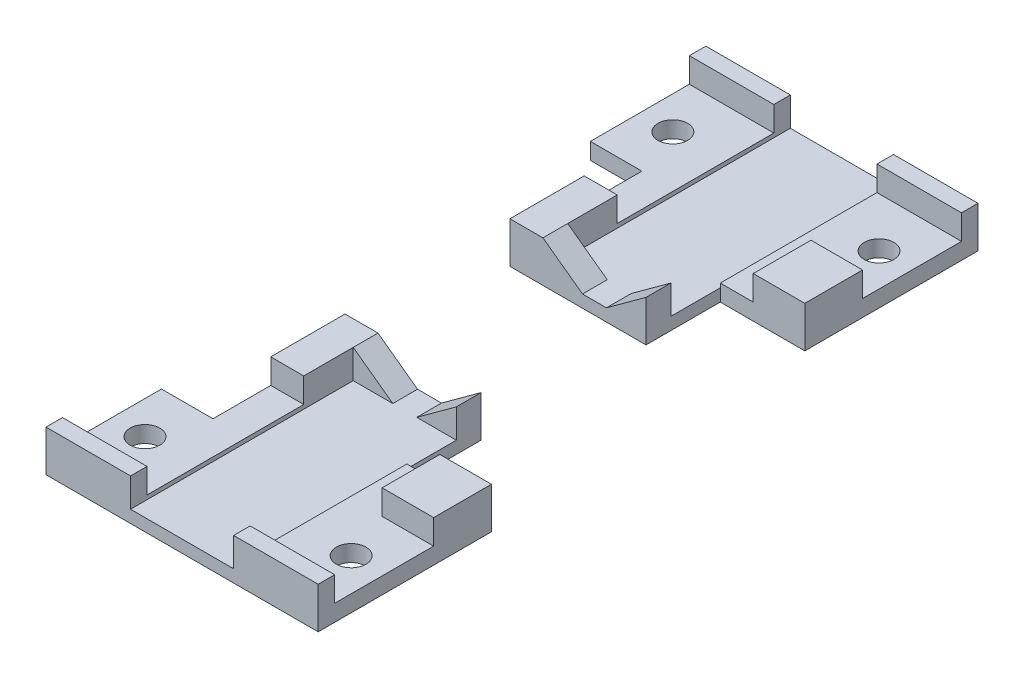
from build123d import *

# Parameters (mm, degrees)
SKETCH1_W                                = 33
SKETCH1_H                                = 30
BOSS_EXTRUDE4_DEPTH                      = 3
SKETCH13_W                               = 10.25
SKETCH13_H                               = 30
BOSS_EXTRUDE5_DEPTH                      = 2
SKETCH14_W                               = 12.5
SKETCH14_H                               = 30
CUT_EXTRUDE7_DEPTH                       = 1.5
BOSS_EXTRUDE6_DEPTH                      = 3
CUT_EXTRUDE12_REACH                      = 56.717
SKETCH25_W                               = 6.25
SKETCH25_H                               = 16
BOSS_EXTRUDE7_DEPTH                      = 23
SKETCH27_W                               = 33
SKETCH27_H                               = 5
BOSS_EXTRUDE8_DEPTH                      = 27
CUT_EXTRUDE13_REACH                      = 56.717
SKETCH28_W                               = 6.25
SKETCH28_H                               = 13
CUT_EXTRUDE16_REACH                      = 56.717
SKETCH29_W                               = 26.75
SKETCH29_H                               = 20
SKETCH30_W                               = 12.5
SKETCH30_H                               = 27
CUT_EXTRUDE17_DEPTH                      = 1.5
CUT_EXTRUDE18_DEPTH                      = 3
CUT_EXTRUDE19_DEPTH                      = 3
SKETCH33_R                               = 1.8
CUT_EXTRUDE20_DEPTH                      = 8
CBORE_START                              = -2.4
CBORE_FOR_M3_PAN_HEAD_SCREW1_OUTLINE_R   = 3.5
CBORE_FOR_M3_PAN_HEAD_SCREW1_DEPTH       = 2.4
CBORE_START_2                            = -5
CBORE_FOR_M3_PAN_HEAD_SCREW1_2_OUTLINE_R = 1.8
CBORE_FOR_M3_PAN_HEAD_SCREW1_2_DEPTH     = 2.6
CUT_EXTRUDE22_DEPTH                      = 1.5
SKETCH39_W                               = 12.5
SKETCH39_H                               = 27
CUT_EXTRUDE24_DEPTH                      = 0.5
SKETCH40_W                               = 9
SKETCH40_H                               = 5
CUT_EXTRUDE26_DEPTH                      = 10.25
SKETCH41_W                               = 9
SKETCH41_H                               = 5
CUT_EXTRUDE27_DEPTH                      = 10.25


# Read off the part's stored shape, not the designer's step: CBORE for M3 Pan Head Screw1
with BuildPart() as part:
    # Sketch1 → Boss-Extrude4 (new body)
    with BuildSketch(Plane(origin=(0, -2, 0), x_dir=(1, 0, 0), z_dir=(0, 1, 0))):
        with Locations((20.5, 25)):
            Rectangle(SKETCH1_W, SKETCH1_H)
    extrude(amount=-BOSS_EXTRUDE4_DEPTH)

    # Sketch13 → Boss-Extrude5 (add)
    with BuildSketch(Plane(origin=(0, -2, 0), x_dir=(1, 0, 0), z_dir=(0, 1, 0))):
        with Locations((9.125, 25)):
            Rectangle(SKETCH13_W, SKETCH13_H)
        with Locations((31.875, 25)):
            Rectangle(SKETCH13_W, SKETCH13_H)
    extrude(amount=BOSS_EXTRUDE5_DEPTH)

    # Sketch14 → Cut-Extrude7 (cut)
    with BuildSketch(Plane(origin=(0, -2, 0), x_dir=(1, 0, 0), z_dir=(0, 1, 0))):
        with Locations((20.5, 25)):
            Rectangle(SKETCH14_W, SKETCH14_H)
    extrude(amount=-CUT_EXTRUDE7_DEPTH, mode=Mode.SUBTRACT)

    # Sketch19 → Boss-Extrude6 (add)
    with BuildSketch(Plane.XY.offset(-10)):
        Polygon((14.25, 0), (19.05, -3.5), (14.25, -3.5), align=None)
    boss_extrude6 = extrude(amount=-BOSS_EXTRUDE6_DEPTH)

    # Mirror3: Boss-Extrude6 across plane
    add(boss_extrude6.mirror(Plane(origin=(20.5, 0, 0), x_dir=(0, 0, 1), z_dir=(1, 0, 0))))

    # Sketch25 → Cut-Extrude12 (cut, up to next)
    with BuildSketch(Plane(origin=(0, 0, 0), x_dir=(1, 0, 0), z_dir=(0, 1, 0)), mode=Mode.PRIVATE) as cut_extrude12_sk1:
        with Locations((7.125, 18)):
            Rectangle(SKETCH25_W, SKETCH25_H)
    cut_extrude12_tool1 = extrude(cut_extrude12_sk1.sketch, amount=-CUT_EXTRUDE12_REACH, mode=Mode.PRIVATE) & part.part
    add(cut_extrude12_tool1.solids().sort_by_distance((7.125, 0, -18))[0], mode=Mode.SUBTRACT)

    # Sketch26 → Boss-Extrude7 (add)
    with BuildSketch(Plane.XY.offset(-10)):
        Polygon((10.25, -5), (10.25, 0), (14.25, 0), (19.05, -3.5), (21.95, -3.5), (26.75, 0), (37, 0), (37, -5), align=None)
    extrude(amount=BOSS_EXTRUDE7_DEPTH)

    # Sketch27 → Boss-Extrude8 (add)
    with BuildSketch(Plane.XY.offset(13)):
        with Locations((20.5, -2.5)):
            Rectangle(SKETCH27_W, SKETCH27_H)
    extrude(amount=BOSS_EXTRUDE8_DEPTH)

    # Sketch28 → Cut-Extrude13 (cut, up to next)
    with BuildSketch(Plane(origin=(0, 0, 0), x_dir=(1, 0, 0), z_dir=(0, 1, 0)), mode=Mode.PRIVATE) as cut_extrude13_sk1:
        with Locations((7.125, -19.5)):
            Rectangle(SKETCH28_W, SKETCH28_H)
    cut_extrude13_tool1 = extrude(cut_extrude13_sk1.sketch, amount=-CUT_EXTRUDE13_REACH, mode=Mode.PRIVATE) & part.part
    add(cut_extrude13_tool1.solids().sort_by_distance((7.125, 0, 19.5))[0], mode=Mode.SUBTRACT)

    # Sketch29 → Cut-Extrude16 (cut, up to next)
    with BuildSketch(Plane(origin=(0, 0, 0), x_dir=(1, 0, 0), z_dir=(0, 1, 0)), mode=Mode.PRIVATE) as cut_extrude16_sk1:
        with Locations((23.625, 0)):
            Rectangle(SKETCH29_W, SKETCH29_H)
    cut_extrude16_tool1 = extrude(cut_extrude16_sk1.sketch, amount=-CUT_EXTRUDE16_REACH, mode=Mode.PRIVATE) & part.part
    add(cut_extrude16_tool1.solids().sort_by_distance((23.625, 0, 0))[0], mode=Mode.SUBTRACT)


with BuildPart() as cut_extrude16_piece_1:
    # of the separate pieces the step leaves, piece 1, a body of its own (cut_extrude16_pieces)
    add(part.part.solids().sort_by_distance((10.25, -5, 26))[0])

    # Sketch30 → Cut-Extrude17 (cut)
    with BuildSketch(Plane(origin=(0, 0, 0), x_dir=(1, 0, 0), z_dir=(0, 1, 0))):
        with Locations((20.5, -26.5)):
            Rectangle(SKETCH30_W, SKETCH30_H)
    extrude(amount=-CUT_EXTRUDE17_DEPTH, mode=Mode.SUBTRACT)

    # Sketch32 → Cut-Extrude19 (cut)
    with BuildSketch(Plane(origin=(0, 0, 0), x_dir=(1, 0, 0), z_dir=(0, 1, 0))):
        Polygon((4, -26), (10.25, -26), (10.25, -19), (14.25, -19), (14.25, -38), (4, -38), align=None)
        Polygon((37, -38), (37, -26), (30.75, -26), (30.75, -19), (26.75, -19), (26.75, -38), align=None)
    extrude(amount=-CUT_EXTRUDE19_DEPTH, mode=Mode.SUBTRACT)


with BuildPart() as cut_extrude16_piece_2:
    # of the separate pieces the step leaves, piece 2, a body of its own (cut_extrude16_pieces)
    add(part.part.solids().sort_by_distance((4, -5, -40))[0])

    # Sketch31 → Cut-Extrude18 (cut)
    with BuildSketch(Plane(origin=(0, 0, 0), x_dir=(1, 0, 0), z_dir=(0, 1, 0))):
        Polygon((4, 38), (14.25, 38), (14.25, 19.008507387), (10.25, 19), (10.25, 26), (4, 26), align=None)
        Polygon((30.75, 19), (26.75, 19), (26.75, 38), (37, 38), (37, 26), (30.75, 26), align=None)
    extrude(amount=-CUT_EXTRUDE18_DEPTH, mode=Mode.SUBTRACT)


with BuildPart() as cut_extrude20_tool:
    # Sketch33 → Cut-Extrude20 (new body)
    with BuildSketch(Plane(origin=(0, 0, 0), x_dir=(1, 0, 0), z_dir=(0, 1, 0))):
        with Locations(Location((8, 32, 0), (0, 0, 270))):
            Circle(SKETCH33_R)
        with Locations(Location((33, 32, 0), (0, 0, 270))):
            Circle(SKETCH33_R)
        with Locations(Location((33, -32, 0), (0, 0, 270))):
            Circle(SKETCH33_R)
        with Locations(Location((8, -32, 0), (0, 0, 270))):
            Circle(SKETCH33_R)
    extrude(amount=-CUT_EXTRUDE20_DEPTH)


with BuildPart() as cut_extrude16_piece_1_1:
    add(cut_extrude16_piece_1.part)

    # Cut-Extrude20: cut by cut_extrude20_tool
    add(cut_extrude20_tool.part, mode=Mode.SUBTRACT)


with BuildPart() as cut_extrude16_piece_2_1:
    add(cut_extrude16_piece_2.part)

    # Cut-Extrude20: cut by cut_extrude20_tool
    add(cut_extrude20_tool.part, mode=Mode.SUBTRACT)


with BuildPart() as cbore_for_m3_pan_head_screw1_tool:
    # CBORE for M3 Pan Head Screw1 outline → CBORE for M3 Pan Head Screw1 (new body)
    with BuildSketch(Plane(origin=(0, 0, 0), x_dir=(1, 0, 0), z_dir=(0, 1, 0)).offset(CBORE_START)):
        with Locations((32, -14.75)):
            Circle(CBORE_FOR_M3_PAN_HEAD_SCREW1_OUTLINE_R)
        with Locations((32, 14.75)):
            Circle(CBORE_FOR_M3_PAN_HEAD_SCREW1_OUTLINE_R)
    extrude(amount=CBORE_FOR_M3_PAN_HEAD_SCREW1_DEPTH)


with BuildPart() as cut_extrude16_piece_1_2:
    add(cut_extrude16_piece_1_1.part)

    # CBORE for M3 Pan Head Screw1: cut by cbore_for_m3_pan_head_screw1_tool
    add(cbore_for_m3_pan_head_screw1_tool.part, mode=Mode.SUBTRACT)


with BuildPart() as cut_extrude16_piece_2_2:
    add(cut_extrude16_piece_2_1.part)

    # CBORE for M3 Pan Head Screw1: cut by cbore_for_m3_pan_head_screw1_tool
    add(cbore_for_m3_pan_head_screw1_tool.part, mode=Mode.SUBTRACT)


with BuildPart() as cbore_for_m3_pan_head_screw1_2_tool:
    # CBORE for M3 Pan Head Screw1 2 outline → CBORE for M3 Pan Head Screw1 2 (new body)
    with BuildSketch(Plane(origin=(0, 0, 0), x_dir=(1, 0, 0), z_dir=(0, 1, 0)).offset(CBORE_START_2)):
        with Locations((32, -14.75)):
            Circle(CBORE_FOR_M3_PAN_HEAD_SCREW1_2_OUTLINE_R)
        with Locations((32, 14.75)):
            Circle(CBORE_FOR_M3_PAN_HEAD_SCREW1_2_OUTLINE_R)
    extrude(amount=CBORE_FOR_M3_PAN_HEAD_SCREW1_2_DEPTH)


with BuildPart() as cut_extrude16_piece_1_3:
    add(cut_extrude16_piece_1_2.part)

    # CBORE for M3 Pan Head Screw1 2: cut by cbore_for_m3_pan_head_screw1_2_tool
    add(cbore_for_m3_pan_head_screw1_2_tool.part, mode=Mode.SUBTRACT)

    # Sketch36 → Cut-Extrude22 (cut)
    with BuildSketch(Plane(origin=(0, -1.5, 0), x_dir=(1, 0, 0), z_dir=(0, 1, 0))):
        Polygon((26.75, -13), (26.75, -38), (26.75, -40), (14.25, -40), (14.25, -38), (14.25, -13), (19.05, -13), (19.05, -10), (21.95, -10), (21.95, -13), align=None)
    extrude(amount=-CUT_EXTRUDE22_DEPTH, mode=Mode.SUBTRACT)

    # Sketch39 → Cut-Extrude24 (cut)
    with BuildSketch(Plane(origin=(0, -3, 0), x_dir=(1, 0, 0), z_dir=(0, 1, 0))):
        with Locations((20.5, -26.5)):
            Rectangle(SKETCH39_W, SKETCH39_H)
    extrude(amount=-CUT_EXTRUDE24_DEPTH, mode=Mode.SUBTRACT)

    # Sketch40 → Cut-Extrude26 (cut)
    with BuildSketch(Plane(origin=(37, 0, 0), x_dir=(0, 0, -1), z_dir=(1, 0, 0))):
        with Locations((-14.5, -2.5)):
            Rectangle(SKETCH40_W, SKETCH40_H)
    extrude(amount=-CUT_EXTRUDE26_DEPTH, mode=Mode.SUBTRACT)


with BuildPart() as cut_extrude16_piece_2_3:
    add(cut_extrude16_piece_2_2.part)

    # CBORE for M3 Pan Head Screw1 2: cut by cbore_for_m3_pan_head_screw1_2_tool
    add(cbore_for_m3_pan_head_screw1_2_tool.part, mode=Mode.SUBTRACT)

    # Sketch41 → Cut-Extrude27 (cut)
    with BuildSketch(Plane(origin=(37, 0, 0), x_dir=(0, 0, -1), z_dir=(1, 0, 0))):
        with Locations((14.5, -2.5)):
            Rectangle(SKETCH41_W, SKETCH41_H)
    extrude(amount=-CUT_EXTRUDE27_DEPTH, mode=Mode.SUBTRACT)


solid = Compound([cut_extrude16_piece_1_3.part, cut_extrude16_piece_2_3.part])
